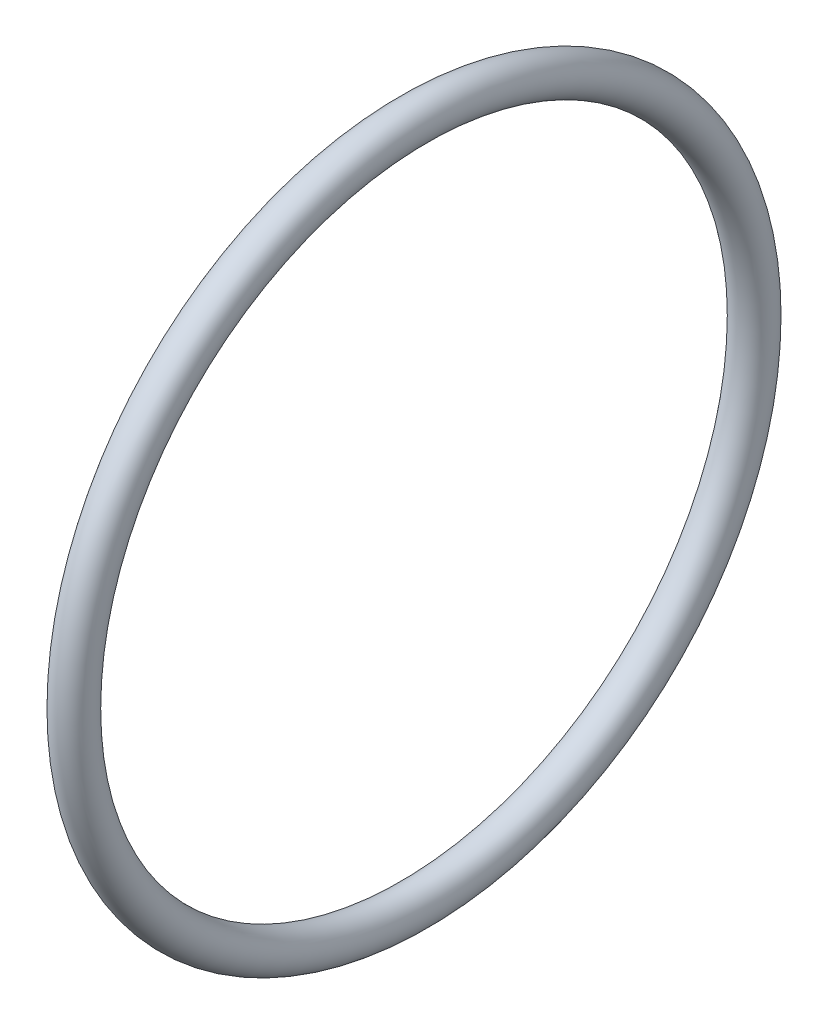
from build123d import *

# Parameters (mm, degrees)
ESQUISSE2_R   = 1.1
ESQUISSE2_R_2 = 0.732622759


with BuildPart() as part:
    # Esquisse2 → Révolution1 (revolve)
    with BuildSketch(Plane(origin=(0, 0, 0), x_dir=(-1, 0, 0), z_dir=(0, 1, 0))):
        with Locations((-2.492989834, 19.681818027)):
            Circle(ESQUISSE2_R)
        with Locations((-2.492989834, 19.681818027)):
            Circle(ESQUISSE2_R_2, mode=Mode.SUBTRACT)
    revolve(axis=Axis((0, 0, 0), (1, 0, 0)))


solid = part.part
